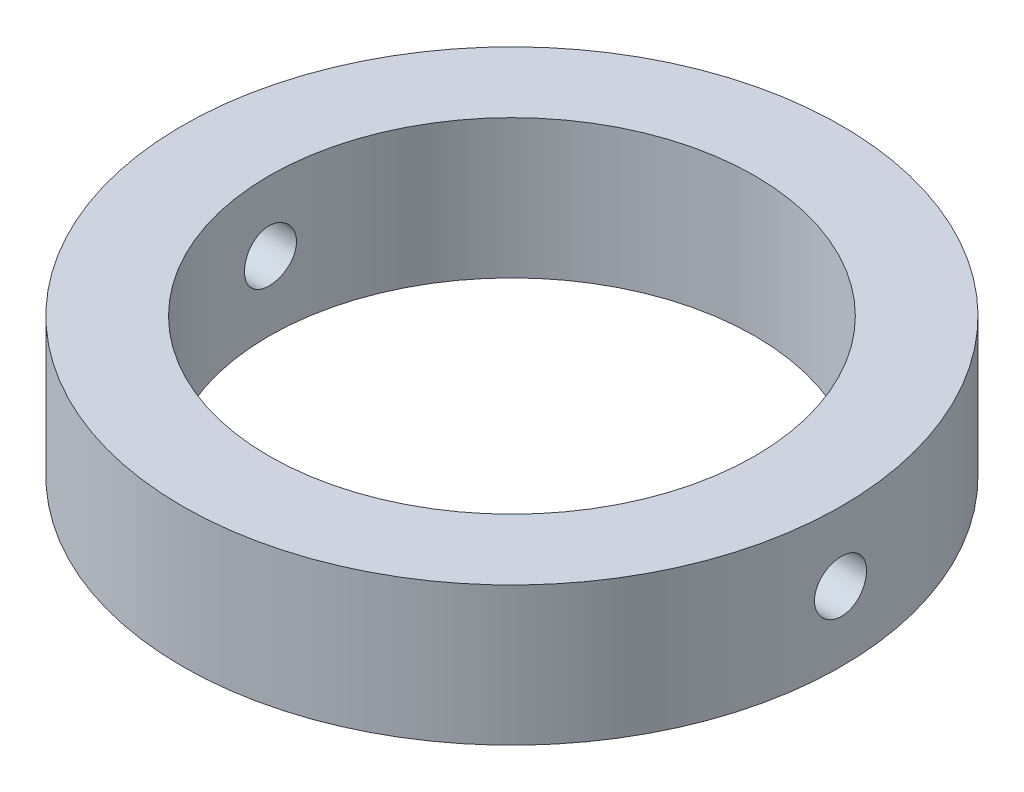
from build123d import *

# Parameters (mm, degrees)
SKETCH_1_R          = 38
SKETCH_1_R_2        = 28
EXTRUDE_1_DEPTH     = 16
SKETCH_2_R          = 3
CUT_EXTRUDE_1_DEPTH = 131


with BuildPart() as part:
    # Эскиз1 → Вытянуть1 (new body)
    with BuildSketch(Plane(origin=(0, 0, 0), x_dir=(1, 0, 0), z_dir=(0, 1, 0))):
        Circle(SKETCH_1_R)
        Circle(SKETCH_1_R_2, mode=Mode.SUBTRACT)
    extrude(amount=EXTRUDE_1_DEPTH)

    # Эскиз2 → Вырез-Вытянуть1 (cut, symmetric)
    with BuildSketch(Plane.ZY.offset(48)):
        with Locations((0, 8)):
            Circle(SKETCH_2_R)
    extrude(amount=CUT_EXTRUDE_1_DEPTH, both=True, mode=Mode.SUBTRACT)


solid = part.part
